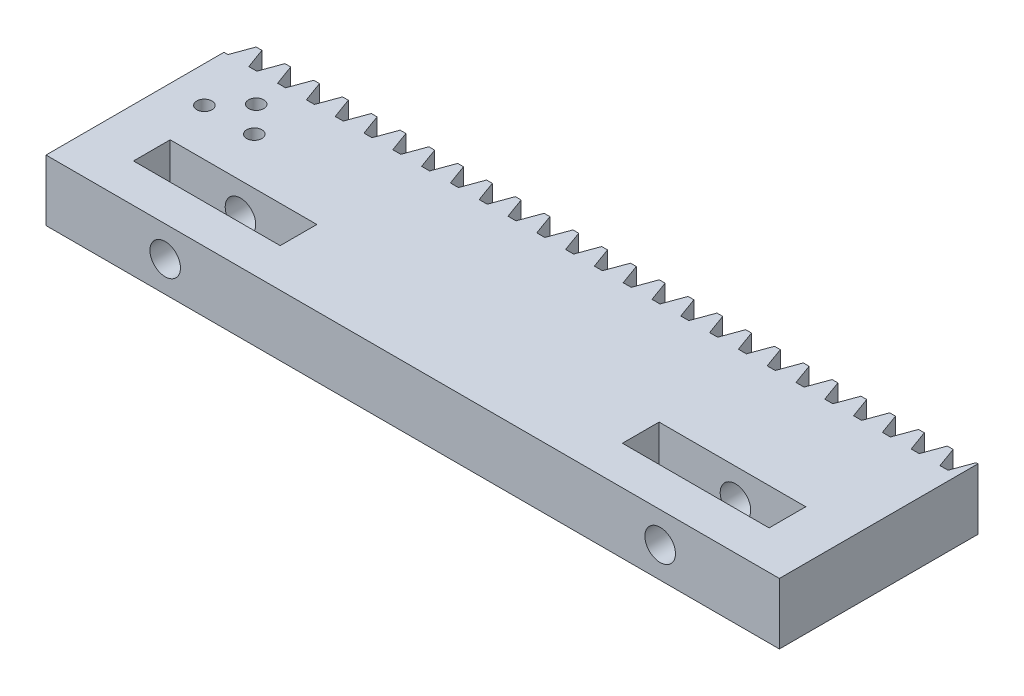
from build123d import *

# Parameters (mm, degrees)
BOSS_EXTRUDE1_DEPTH = 5
SKETCH3_W           = 120
SKETCH3_H           = 6
BOSS_EXTRUDE2_DEPTH = 10
SKETCH5_W           = 24
SKETCH5_H           = 6
CUT_EXTRUDE1_DEPTH  = 10
CUT_EXTRUDE2_START  = -5
SKETCH7_R           = 2.5
CUT_EXTRUDE2_DEPTH  = 25
SKETCH8_R           = 1.25
CUT_EXTRUDE3_DEPTH  = 20
SKETCH9_R           = 1.25
CUT_EXTRUDE4_DEPTH  = 10


with BuildPart() as part:
    # Sketch1 → Boss-Extrude1 (new, symmetric)
    with BuildSketch(Plane(origin=(0, 0, 0), x_dir=(1, 0, 0), z_dir=(0, 1, 0))):
        Polygon((58.46437743, 9.875), (57.15507132, 9.875), (55.92667178, 13.25), (54.980387995, 13.25), (53.751988455, 9.875), (52.442682345, 9.875), (51.214282805, 13.25), (50.26799902, 13.25), (49.03959948, 9.875), (47.73029337, 9.875), (46.50189383, 13.25), (45.555610045, 13.25), (44.327210505, 9.875), (43.017904395, 9.875), (41.789504855, 13.25), (40.84322107, 13.25), (39.61482153, 9.875), (38.30551542, 9.875), (37.07711588, 13.25), (36.130832095, 13.25), (34.902432555, 9.875), (33.593126445, 9.875), (32.364726905, 13.25), (31.41844312, 13.25), (30.19004358, 9.875), (28.88073747, 9.875), (27.65233793, 13.25), (26.706054145, 13.25), (25.477654605, 9.875), (24.168348495, 9.875), (22.939948955, 13.25), (21.99366517, 13.25), (20.76526563, 9.875), (19.45595952, 9.875), (18.22755998, 13.25), (17.281276195, 13.25), (16.052876655, 9.875), (14.743570545, 9.875), (13.515171005, 13.25), (12.56888722, 13.25), (11.34048768, 9.875), (10.03118157, 9.875), (8.80278203, 13.25), (7.856498245, 13.25), (6.628098705, 9.875), (5.318792595, 9.875), (4.090393055, 13.25), (3.14410927, 13.25), (1.91570973, 9.875), (0.60640362, 9.875), (-0.62199592, 13.25), (-1.568279705, 13.25), (-2.796679245, 9.875), (-4.105985355, 9.875), (-5.334384895, 13.25), (-6.28066868, 13.25), (-7.50906822, 9.875), (-8.81837433, 9.875), (-10.04677387, 13.25), (-10.993057655, 13.25), (-12.221457195, 9.875), (-13.530763305, 9.875), (-14.759162845, 13.25), (-15.70544663, 13.25), (-16.93384617, 9.875), (-18.24315228, 9.875), (-19.47155182, 13.25), (-20.417835605, 13.25), (-21.646235145, 9.875), (-22.955541255, 9.875), (-24.183940795, 13.25), (-25.13022458, 13.25), (-26.35862412, 9.875), (-27.66793023, 9.875), (-28.89632977, 13.25), (-29.842613555, 13.25), (-31.071013095, 9.875), (-32.380319205, 9.875), (-33.608718745, 13.25), (-34.55500253, 13.25), (-35.78340207, 9.875), (-37.09270818, 9.875), (-38.32110772, 13.25), (-39.267391505, 13.25), (-40.495791045, 9.875), (-41.805097155, 9.875), (-43.033496695, 13.25), (-43.97978048, 13.25), (-45.20818002, 9.875), (-46.51748613, 9.875), (-47.74588567, 13.25), (-48.692169455, 13.25), (-49.920568995, 9.875), (-51.229875105, 9.875), (-52.458274645, 13.25), (-53.40455843, 13.25), (-54.63295797, 9.875), (-55.94226408, 9.875), (-57.17066362, 13.25), (-58.116947405, 13.25), (-59.345346945, 9.875), (-60, 9.875), (-60, -13.25), (60, -13.25), (60, 13.25), (59.69277697, 13.25), align=None)
    extrude(amount=BOSS_EXTRUDE1_DEPTH, both=True)

    # Sketch3 → Boss-Extrude2 (add)
    with BuildSketch(Plane(origin=(0, 5, 0), x_dir=(1, 0, 0), z_dir=(0, 1, 0))):
        with Locations((0, -16.25)):
            Rectangle(SKETCH3_W, SKETCH3_H)
    extrude(amount=-BOSS_EXTRUDE2_DEPTH)

    # Sketch5 → Cut-Extrude1 (cut)
    with BuildSketch(Plane(origin=(0, 5, 0), x_dir=(1, 0, 0), z_dir=(0, 1, 0))):
        with Locations((-40, -9.932851702)):
            Rectangle(SKETCH5_W, SKETCH5_H)
        with Locations((40, -9.932851702)):
            Rectangle(SKETCH5_W, SKETCH5_H)
    extrude(amount=-CUT_EXTRUDE1_DEPTH, mode=Mode.SUBTRACT)

    # Sketch7 → Cut-Extrude2 (cut)
    with BuildSketch(Plane.XY.offset(6.932851702).offset(CUT_EXTRUDE2_START)):
        with Locations((-40.495791045, 0)):
            Circle(SKETCH7_R)
    cut_extrude2 = extrude(amount=CUT_EXTRUDE2_DEPTH, mode=Mode.SUBTRACT)

    # Mirror1: Cut-Extrude2 across plane
    add(cut_extrude2.mirror(Plane(origin=(0, 0, 0), x_dir=(0, 0, 1), z_dir=(1, 0, 0))), mode=Mode.SUBTRACT)

    # Sketch8 → Cut-Extrude3 (cut)
    with BuildSketch(Plane(origin=(0, 5, 0), x_dir=(1, 0, 0), z_dir=(0, 1, 0))):
        with Locations((-54.081860638, 0.75)):
            Circle(SKETCH8_R)
        with Locations((-45.918139363, 0.75)):
            Circle(SKETCH8_R)
    extrude(amount=-CUT_EXTRUDE3_DEPTH, mode=Mode.SUBTRACT)

    # Sketch9 → Cut-Extrude4 (cut)
    with BuildSketch(Plane(origin=(0, 5, 0), x_dir=(1, 0, 0), z_dir=(0, 1, 0))):
        with Locations((-50, 5.147546331)):
            Circle(SKETCH9_R)
    extrude(amount=-CUT_EXTRUDE4_DEPTH, mode=Mode.SUBTRACT)


solid = part.part
